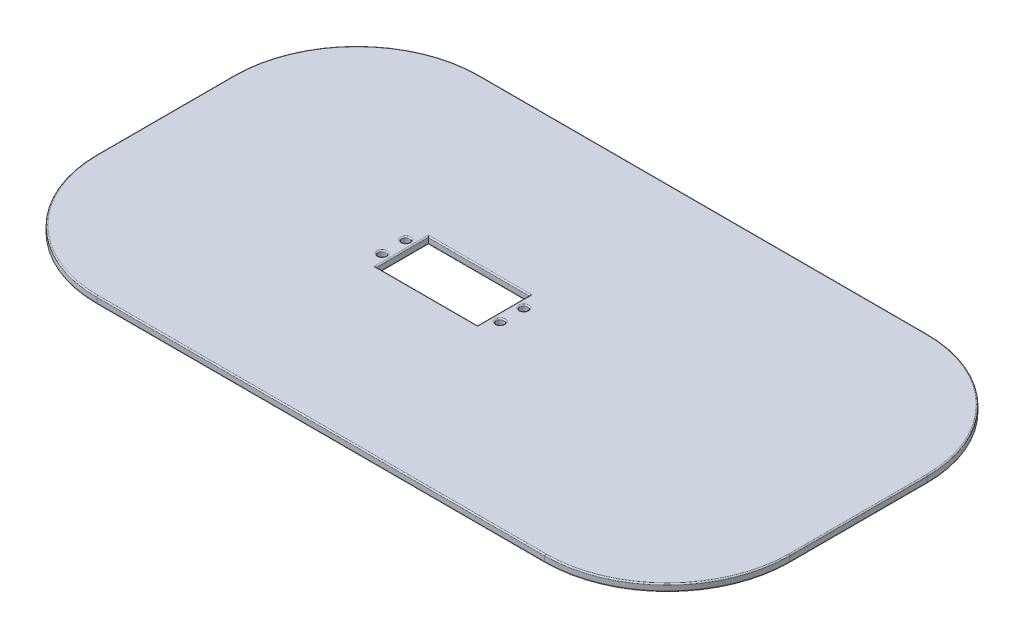
from build123d import *

# Parameters (mm, degrees)
SKETCH_1_W      = 285.358012304
SKETCH_1_H      = 157.490287618
SKETCH_1_R      = 1.575
SKETCH_1_W_2    = 41.75
SKETCH_1_H_2    = 21.5
EXTRUDE_1_DEPTH = 3
FILLET_1_R      = 0.5
FILLET_2_R      = 50.5


with BuildPart() as part:
    # 草图1 → 凸台-拉伸1 (new body)
    with BuildSketch(Plane(origin=(0, 1.5, 0), x_dir=(1, 0, 0), z_dir=(0, 1, 0))):
        with Locations((15.625, 0)):
            Rectangle(SKETCH_1_W, SKETCH_1_H)
        with Locations(Location((-32.975, 4.875, 0), (0, 0, 90))):
            Circle(SKETCH_1_R, mode=Mode.SUBTRACT)
        with Locations(Location((-32.975, -4.875, 0), (0, 0, 90))):
            Circle(SKETCH_1_R, mode=Mode.SUBTRACT)
        with Locations(Location((15.625, -4.875, 0), (0, 0, 90))):
            Circle(SKETCH_1_R, mode=Mode.SUBTRACT)
        with Locations(Location((15.625, 4.875, 0), (0, 0, 90))):
            Circle(SKETCH_1_R, mode=Mode.SUBTRACT)
        with Locations((-8.675, 0)):
            Rectangle(SKETCH_1_W_2, SKETCH_1_H_2, mode=Mode.SUBTRACT)
    extrude(amount=-EXTRUDE_1_DEPTH)

    # 圆角1
    fillet_1_edges = [part.edges().sort_by_distance(p)[0] for p in [
        (-127.054006152, -1.5, 0),
        (12.2, -1.5, 0),
        (-8.675, -1.5, 10.75),
        (-29.55, -1.5, 0),
        (-8.675, -1.5, -10.75),
        (12.2, 1.5, 0),
        (15.625, -1.5, 78.745143809),
        (-8.675, 1.5, -10.75),
        (-29.55, 1.5, 0),
        (-8.675, 1.5, 10.75),
        (-32.975, -1.5, -3.3),
        (-32.975, 1.5, -3.3),
        (-32.975, -1.5, 6.45),
        (-32.975, 1.5, 6.45),
        (15.625, -1.5, 6.45),
        (15.625, 1.5, 6.45),
        (15.625, -1.5, -3.3),
        (15.625, 1.5, -3.3),
        (158.304006152, -1.5, 0),
        (15.625, 1.5, 78.745143809),
        (-127.054006152, 1.5, 0),
        (15.625, 1.5, -78.745143809),
        (158.304006152, 1.5, 0),
        (15.625, -1.5, -78.745143809),
    ]]
    fillet(fillet_1_edges, radius=FILLET_1_R)

    # 圆角2
    # the kernel refuses this fillet: 50.5 mm, written as the material it takes off along each edge
    with BuildSketch(Plane(origin=(-76.554006152, 1.5, -28.245143809), x_dir=(0, 0, -1), z_dir=(1, 0, 0))) as fillet_2_piece_1:
        with BuildLine():
            CenterArc((50, -0.5), 0.5, 0, 90)
            Line((50.5, -0.5), (50.5, 0))
            Line((50.5, 0), (50, 0))
        make_face()
    revolve(axis=Axis((-76.554006152, 1.5, -28.245143809), (0, 1, 0)), revolution_arc=90, mode=Mode.SUBTRACT)
    with BuildSketch(Plane(origin=(107.804006152, 1.5, -28.245143809), x_dir=(1, 0, 0), z_dir=(0, 0, 1))) as fillet_2_piece_2:
        with BuildLine():
            CenterArc((50, -0.5), 0.5, 0, 90)
            Line((50.5, -0.5), (50.5, 0))
            Line((50.5, 0), (50, 0))
        make_face()
    revolve(axis=Axis((107.804006152, 1.5, -28.245143809), (0, 1, 0)), revolution_arc=90, mode=Mode.SUBTRACT)
    with BuildSketch(Plane(origin=(-76.554006152, 1.5, 28.245143809), x_dir=(-1, 0, 0), z_dir=(0, 0, -1))) as fillet_2_piece_3:
        with BuildLine():
            CenterArc((50, -0.5), 0.5, 0, 90)
            Line((50.5, -0.5), (50.5, 0))
            Line((50.5, 0), (50, 0))
        make_face()
    revolve(axis=Axis((-76.554006152, 1.5, 28.245143809), (0, 1, 0)), revolution_arc=90, mode=Mode.SUBTRACT)
    with BuildSketch(Plane(origin=(107.804006152, 1.5, 28.245143809), x_dir=(0, 0, 1), z_dir=(-1, 0, 0))) as fillet_2_piece_4:
        with BuildLine():
            CenterArc((50, -0.5), 0.5, 0, 90)
            Line((50.5, -0.5), (50.5, 0))
            Line((50.5, 0), (50, 0))
        make_face()
    revolve(axis=Axis((107.804006152, 1.5, 28.245143809), (0, 1, 0)), revolution_arc=90, mode=Mode.SUBTRACT)
    with BuildSketch(Plane(origin=(107.804006152, -1.5, 28.245143809), x_dir=(1, 0, 0), z_dir=(0, 0, -1))) as fillet_2_piece_5:
        with BuildLine():
            CenterArc((50, -0.5), 0.5, 0, 90)
            Line((50.5, -0.5), (50.5, 0))
            Line((50.5, 0), (50, 0))
        make_face()
    revolve(axis=Axis((107.804006152, -1.5, 28.245143809), (0, -1, 0)), revolution_arc=90, mode=Mode.SUBTRACT)
    with BuildSketch(Plane(origin=(-76.554006152, -1.5, 28.245143809), x_dir=(0, 0, 1), z_dir=(1, 0, 0))) as fillet_2_piece_6:
        with BuildLine():
            CenterArc((50, -0.5), 0.5, 0, 90)
            Line((50.5, -0.5), (50.5, 0))
            Line((50.5, 0), (50, 0))
        make_face()
    revolve(axis=Axis((-76.554006152, -1.5, 28.245143809), (0, -1, 0)), revolution_arc=90, mode=Mode.SUBTRACT)
    with BuildSketch(Plane(origin=(107.804006152, -1.5, -28.245143809), x_dir=(0, 0, -1), z_dir=(-1, 0, 0))) as fillet_2_piece_7:
        with BuildLine():
            CenterArc((50, -0.5), 0.5, 0, 90)
            Line((50.5, -0.5), (50.5, 0))
            Line((50.5, 0), (50, 0))
        make_face()
    revolve(axis=Axis((107.804006152, -1.5, -28.245143809), (0, -1, 0)), revolution_arc=90, mode=Mode.SUBTRACT)
    with BuildSketch(Plane(origin=(-76.554006152, -1.5, -28.245143809), x_dir=(-1, 0, 0), z_dir=(0, 0, 1))) as fillet_2_piece_8:
        with BuildLine():
            CenterArc((50, -0.5), 0.5, 0, 90)
            Line((50.5, -0.5), (50.5, 0))
            Line((50.5, 0), (50, 0))
        make_face()
    revolve(axis=Axis((-76.554006152, -1.5, -28.245143809), (0, -1, 0)), revolution_arc=90, mode=Mode.SUBTRACT)
    with BuildSketch(Plane(origin=(158.304006152, 1.5, -78.745143809), x_dir=(0, 0, 1), z_dir=(0, -1, 0)), Plane(origin=(158.304006152, 1.5, 78.745143809), x_dir=(-1, 0, 0), z_dir=(0, -1, 0))) as fillet_2_piece_9:
        with BuildLine():
            CenterArc((FILLET_2_R, FILLET_2_R), FILLET_2_R, 180, 90)
            Line((0, FILLET_2_R), (0, 0))
            Line((0, 0), (FILLET_2_R, 0))
        make_face()
    extrude(amount=3, mode=Mode.SUBTRACT)
    with BuildSketch(Plane(origin=(-127.054006152, 1.5, -78.745143809), x_dir=(0, 0, 1), z_dir=(0, -1, 0)), Plane(origin=(-127.054006152, 1.5, 78.745143809), x_dir=(1, 0, 0), z_dir=(0, -1, 0))) as fillet_2_piece_10:
        with BuildLine():
            CenterArc((FILLET_2_R, -FILLET_2_R), FILLET_2_R, 90, 90)
            Line((0, -FILLET_2_R), (0, 0))
            Line((0, 0), (FILLET_2_R, 0))
        make_face()
    extrude(amount=3, mode=Mode.SUBTRACT)


solid = part.part
